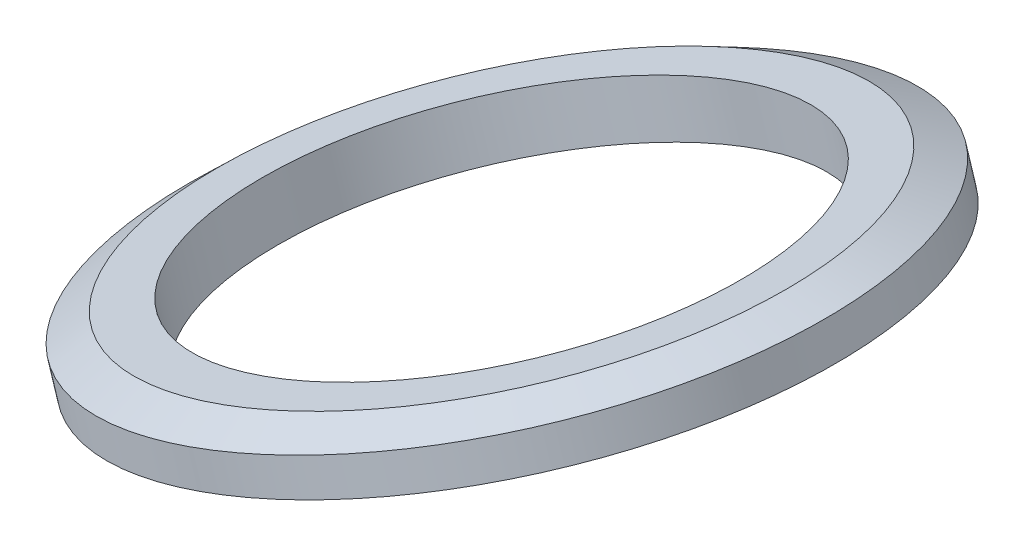
from build123d import *


with BuildPart() as part:
    # Sk_Cono → Cono (revolve)
    with BuildSketch(Plane.XY):
        Polygon((422.135970869, 400.541358432), (424.710999414, 401.353286995), (426.919142249, 401.001001285), (427.520570814, 399.093572733), (423.038113717, 397.680215604), align=None)
    revolve(axis=Axis((406.994285309, 401.00971557, 0), (0.3007142826457722, -0.9537142759825076, 0)))


solid = part.part
